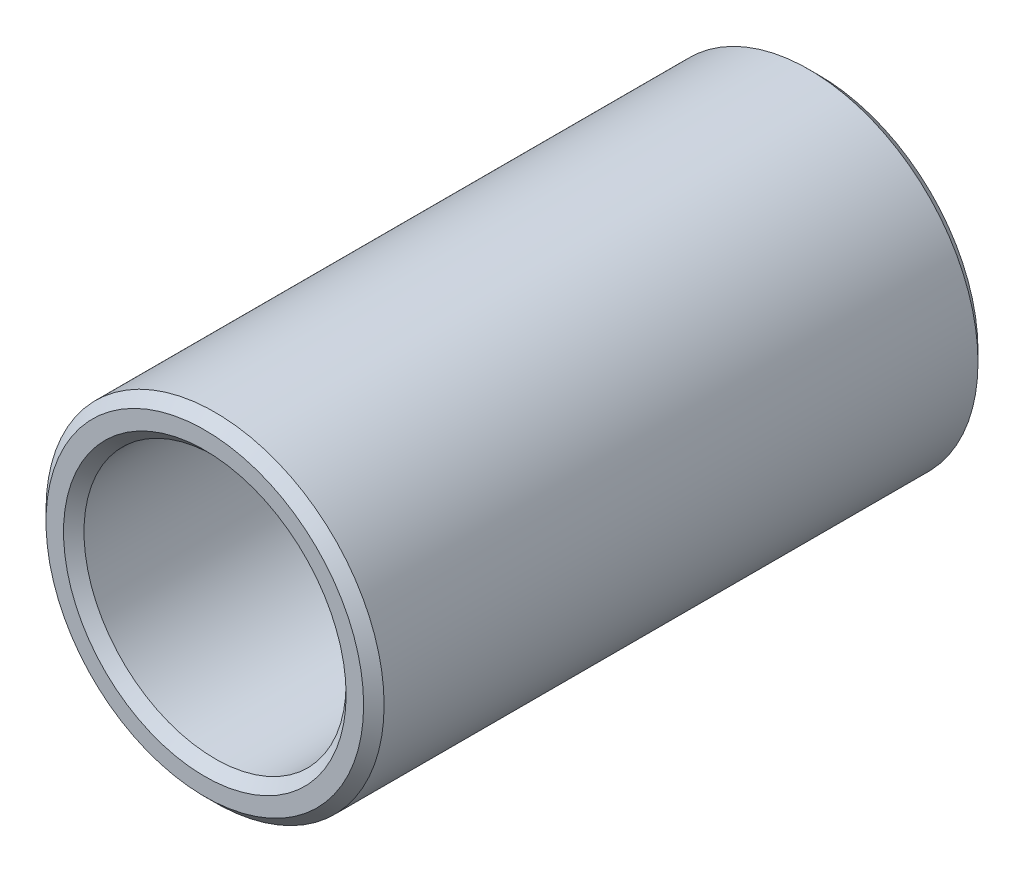
from build123d import *

# Parameters (mm, degrees)
SKETCH1_R           = 4.1275
SKETCH1_R_2         = 3.2
BOSS_EXTRUDE1_DEPTH = 15
CHAMFER1_SIZE       = 0.25


with BuildPart() as part:
    # Sketch1 → Boss-Extrude1 (new body)
    with BuildSketch(Plane.XY):
        Circle(SKETCH1_R)
        Circle(SKETCH1_R_2, mode=Mode.SUBTRACT)
    extrude(amount=BOSS_EXTRUDE1_DEPTH)

    # Chamfer1
    chamfer1_edges = [part.edges().sort_by_distance(p)[0] for p in [
        (-3.2, 0, 15),
        (-4.1275, 0, 15),
        (-3.2, 0, 0),
        (-4.1275, 0, 0),
    ]]
    chamfer(chamfer1_edges, length=CHAMFER1_SIZE)


solid = part.part
